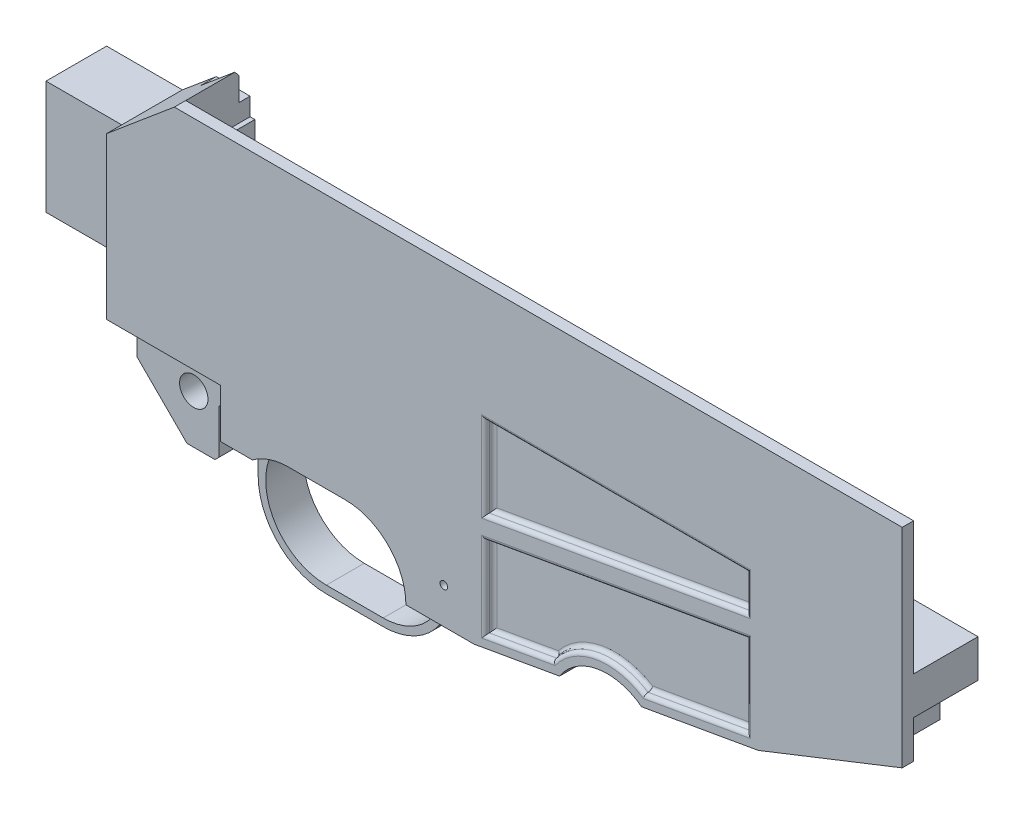
from build123d import *

# Parameters (mm, degrees)
EXTRUDE_1_DEPTH      = 20
SKETCH_3_W           = 72.75
SKETCH_3_H           = 52
CUT_EXTRUDE_1_DEPTH  = 8
SKETCH_4_W           = 173.123696111
SKETCH_4_H           = 12.22
CUT_EXTRUDE_2_DEPTH  = 17
CUT_EXTRUDE_3_DEPTH  = 14
CUT_EXTRUDE_4_DEPTH  = 5
CUT_EXTRUDE_5_DEPTH  = 8
CUT_EXTRUDE_7_REACH  = 254.082
SKETCH_9_W           = 18
SKETCH_9_H           = 10
SKETCH_9_W_2         = 7.5
SKETCH_9_4_W         = 7.5
SKETCH_9_4_H         = 10
SKETCH_9_4_W_2       = 18
CUT_EXTRUDE_9_DEPTH  = 30.86
FILLET_START         = 50
FILLET_2_DEPTH       = 1.9999999
FILLET_START_2       = 51.9999999
FILLET_2_2_DEPTH     = 6.480525325
FILLET_START_3       = 10
FILLET_2_3_DEPTH     = 10.0000001
SKETCH_8_W           = 8.39
SKETCH_8_H           = 12.86
CUT_EXTRUDE_11_DEPTH = 6
CHAMFER_2_SIZE       = 1
FILLET_3_SIZE        = 6
FILLET_3_SIZE_2      = 8
SKETCH_11_W          = 118.13
SKETCH_11_H          = 35
CUT_EXTRUDE_15_DEPTH = 17
SKETCH_12_W          = 10
SKETCH_12_H          = 25
CUT_EXTRUDE_16_DEPTH = 17
CUT_EXTRUDE_18_REACH = 248.442
SKETCH_18_R          = 1.75
CUT_EXTRUDE_20_DEPTH = 6
CUT_EXTRUDE_21_DEPTH = 4.25
CUT_EXTRUDE_22_REACH = 248.028
SKETCH_21_R          = 1
FILLET_5_R           = 2
CUT_EXTRUDE_23_REACH = 247.923
SKETCH_22_R          = 3.75
CHAMFER_3_SIZE       = 1
SKETCH_23_W          = 4.5
SKETCH_23_H          = 35
CUT_EXTRUDE_24_DEPTH = 2
SKETCH_24_R          = 2.5
CUT_EXTRUDE_25_DEPTH = 5
SKETCH_25_W          = 20
SKETCH_25_H          = 30
CUT_EXTRUDE_26_DEPTH = 4
CUT_EXTRUDE_27_DEPTH = 2
FILLET_6_R           = 1
SKETCH_32_W          = 3
SKETCH_32_H          = 7.5
CUT_EXTRUDE_28_DEPTH = 10
CHAMFER_5_SIZE       = 1
SKETCH_33_R          = 2
CUT_EXTRUDE_29_DEPTH = 246.408981914
CHAMFER_6_SIZE       = 1
EXTRUDE_2_DEPTH      = 2
CHAMFER_7_SIZE       = 0.5


with BuildPart() as part:
    # 스케치2 → 보스-돌출1 (new body)
    with BuildSketch(Plane.XY):
        with BuildLine():
            Line((0, 0), (20, 0))
            Line((20, 0), (37.876303889, 15))
            Line((37.876303889, 15), (230, 15))
            Line((230, 15), (230, -54.995476447))
            Line((230, -54.995476447), (192, -54.995476447))
            Line((192, -54.995476447), (161.21786811, -60.423196823))
            ThreePointArc((161.21786811, -60.423196823), (149.551131055, -57.604318381), (139.552097544, -64.243456731))
            Line((139.552097544, -64.243456731), (117, -68.22))
            Line((117, -68.22), (101, -68.22))
            ThreePointArc((101, -68.22), (95.727922061, -80.947922061), (83, -86.22))
            Line((83, -86.22), (68, -86.22))
            ThreePointArc((68, -86.22), (55.272077939, -80.947922061), (50, -68.22))
            Line((50, -68.22), (33.22, -68.22))
            Line((33.22, -68.22), (20, -55))
            Line((20, -55), (20, -30))
            Line((20, -30), (0, -30))
            Line((0, -30), (0, 0))
        make_face()
        with BuildLine():
            Line((68, -52.22), (83, -52.22))
            ThreePointArc((83, -52.22), (99, -68.22), (83, -84.22))
            Line((83, -84.22), (68, -84.22))
            ThreePointArc((68, -84.22), (52, -68.22), (68, -52.22))
        make_face(mode=Mode.SUBTRACT)
    extrude(amount=EXTRUDE_1_DEPTH)

    # 스케치3 → 컷-돌출1 (cut)
    with BuildSketch(Plane(origin=(0, 0, 0), x_dir=(-1, 0, 0), z_dir=(0, 0, -1))):
        with Locations((-75.5, -23.22)):
            Rectangle(SKETCH_3_W, SKETCH_3_H)
    extrude(amount=-CUT_EXTRUDE_1_DEPTH, mode=Mode.SUBTRACT)

    # 스케치4 → 컷-돌출2 (cut)
    with BuildSketch(Plane(origin=(0, 0, 0), x_dir=(-1, 0, 0), z_dir=(0, 0, -1))):
        with Locations((-124.438151944, 8.89)):
            Rectangle(SKETCH_4_W, SKETCH_4_H)
    extrude(amount=-CUT_EXTRUDE_2_DEPTH, mode=Mode.SUBTRACT)

    # 스케치5 → 컷-돌출3 (cut)
    with BuildSketch(Plane(origin=(0, 0, 0), x_dir=(-1, 0, 0), z_dir=(0, 0, -1))):
        with BuildLine():
            Line((-117, 2.78), (-192, 2.78))
            Line((-192, 2.78), (-192, -54.995476447))
            Line((-192, -54.995476447), (-161.21786811, -60.423196823))
            ThreePointArc((-161.21786811, -60.423196823), (-149.551131055, -57.604318381), (-139.552097544, -64.243456731))
            Line((-139.552097544, -64.243456731), (-117, -68.22))
            Line((-117, -68.22), (-117, 2.78))
        make_face()
    extrude(amount=-CUT_EXTRUDE_3_DEPTH, mode=Mode.SUBTRACT)

    # 스케치6 → 컷-돌출4 (cut)
    with BuildSketch(Plane(origin=(0, 0, 0), x_dir=(-1, 0, 0), z_dir=(0, 0, -1))):
        with BuildLine():
            Line((-88, -49.22), (-63, -49.22))
            Line((-63, -49.22), (-63, -53.021315846))
            ThreePointArc((-63, -53.021315846), (-65.468098191, -52.421599029), (-68, -52.22))
            Line((-68, -52.22), (-83, -52.22))
            ThreePointArc((-83, -52.22), (-85.531901809, -52.421599029), (-88, -53.021315846))
            Line((-88, -53.021315846), (-88, -49.22))
        make_face()
    extrude(amount=-CUT_EXTRUDE_4_DEPTH, mode=Mode.SUBTRACT)

    # 스케치7 → 컷-돌출5 (cut)
    with BuildSketch(Plane.XY.offset(20)):
        Polygon((20, -42.5), (50, -42.5), (50, -68.22), (33.22, -68.22), (20, -55), align=None)
    extrude(amount=-CUT_EXTRUDE_5_DEPTH, mode=Mode.SUBTRACT)

    # 컷-돌출7: up to this face of the body (flat: up to its plane)
    cut_extrude_7_end = Plane(part.part.faces().sort_by_distance((109, -68.22, 10))[0])
    # 스케치9 → 컷-돌출7 (cut, up to the picked face)
    with BuildSketch(Plane.XZ.offset(86.22), mode=Mode.PRIVATE) as cut_extrude_7_sk1:
        with Locations((92, 15)):
            Rectangle(SKETCH_9_W, SKETCH_9_H)
    cut_extrude_7_tool1 = split(extrude(cut_extrude_7_sk1.sketch, amount=-CUT_EXTRUDE_7_REACH, mode=Mode.PRIVATE), bisect_by=cut_extrude_7_end, keep=Keep.BOTH, mode=Mode.PRIVATE)
    # 스케치9 → 컷-돌출7 (cut, up to the picked face)
    with BuildSketch(Plane.XZ.offset(86.22), mode=Mode.PRIVATE) as cut_extrude_7_sk2:
        with Locations((79.25, 15)):
            Rectangle(SKETCH_9_W_2, SKETCH_9_H)
    cut_extrude_7_tool2 = split(extrude(cut_extrude_7_sk2.sketch, amount=-CUT_EXTRUDE_7_REACH, mode=Mode.PRIVATE), bisect_by=cut_extrude_7_end, keep=Keep.BOTH, mode=Mode.PRIVATE)
    add(cut_extrude_7_tool1.solids().sort_by(Axis((92, -86.22, 15), (0, 1, 0)))[0], mode=Mode.SUBTRACT)
    add(cut_extrude_7_tool2.solids().sort_by(Axis((79.25, -86.22, 15), (0, 1, 0)))[0], mode=Mode.SUBTRACT)

    # 스케치9<4> → 컷-돌출9 (cut)
    with BuildSketch(Plane.XZ.offset(86.22)):
        with Locations((71.75, 15)):
            Rectangle(SKETCH_9_4_W, SKETCH_9_4_H)
        with Locations((59, 15)):
            Rectangle(SKETCH_9_4_W_2, SKETCH_9_4_H)
    extrude(amount=-CUT_EXTRUDE_9_DEPTH, mode=Mode.SUBTRACT)

    # 필렛2: read off the stored shape, not the designer's step
    # 필렛2 outline → 필렛2 (add)
    with BuildSketch(Plane.YZ.offset(FILLET_START)):
        with BuildLine():
            Line((-55.36, 10), (-55.36, 19))
            add(Edge.make_bspline(
                [(-55.36, 19), (-55.36, 10), (-62.86, 10)],
                knots=[0, 0, 0, 1, 1, 1], degree=2, weights=[1, 0.707106781, 1]))
            Line((-62.86, 10), (-55.36, 10))
        make_face()
    extrude(amount=FILLET_2_DEPTH)

    # Fillet 2 2 outline → Fillet 2 2 (add)
    with BuildSketch(Plane.YZ.offset(FILLET_START_2)):
        with BuildLine():
            Line((-55.36, 10), (-55.36, 19))
            add(Edge.make_bspline(
                [(-55.36, 19), (-55.36, 10), (-62.86, 10)],
                knots=[0, 0, 0, 1, 1, 1], degree=2, weights=[1, 0.707106781, 1]))
            Line((-62.86, 10), (-55.36, 10))
        make_face()
    extrude(amount=FILLET_2_2_DEPTH)

    # Fillet 2 3 outline → Fillet 2 3 (cut)
    with BuildSketch(Plane.XY.offset(FILLET_START_3)):
        with BuildLine():
            ThreePointArc((58.480525225, -55.36), (54.796795727, -59.182555841), (52.566542837, -64))
            Line((52.566542837, -64), (58.480525225, -64))
            Line((58.480525225, -64), (58.480525225, -55.36))
        make_face()
    extrude(amount=FILLET_2_3_DEPTH, mode=Mode.SUBTRACT)

    # 스케치8 → 컷-돌출11 (cut)
    with BuildSketch(Plane.XY.offset(12)):
        with Locations((45.805, -61.79)):
            Rectangle(SKETCH_8_W, SKETCH_8_H)
    extrude(amount=-CUT_EXTRUDE_11_DEPTH, mode=Mode.SUBTRACT)

    # 모따기2
    chamfer_2_edges = [part.edges().sort_by_distance(p)[0] for p in [
        (41.61, -68.22, 9),
    ]]
    chamfer(chamfer_2_edges, length=CHAMFER_2_SIZE)

    # 필렛3
    # a fillet whose section is not a circle: 8, 6 mm, written as the material it adds along each edge
    with BuildSketch(Plane(origin=(121, -68.22, 10), x_dir=(0, 0, 1), z_dir=(-1, 0, 0))) as fillet_3_piece_1_section:
        with BuildLine():
            Bezier((FILLET_3_SIZE, 0), (0, 0), (0, -FILLET_3_SIZE_2), weights=[1, 0.707106781, 1])
            Line((0, -FILLET_3_SIZE_2), (0, 0))
            Line((0, 0), (FILLET_3_SIZE, 0))
        make_face()
    fillet_3_piece_1 = extrude(amount=42, mode=Mode.PRIVATE)
    fillet_3_piece_1 = fillet_3_piece_1 - Plane(origin=(83, -68.22, 10), x_dir=(0, 1, 0), z_dir=(0, 0, -1)) * Cylinder(16, 117, mode=Mode.PRIVATE)
    fillet_3_piece_1 = fillet_3_piece_1 & Plane(origin=(83, -68.22, 10), x_dir=(1, 0, 0), z_dir=(0, 0, -1)) * Cylinder(18, 117, mode=Mode.PRIVATE)
    add(fillet_3_piece_1)

    # 스케치11 → 컷-돌출15 (cut)
    with BuildSketch(Plane(origin=(0, 0, 0), x_dir=(-1, 0, 0), z_dir=(0, 0, -1))):
        with Locations((-170.935, -2.5)):
            Rectangle(SKETCH_11_W, SKETCH_11_H)
    extrude(amount=-CUT_EXTRUDE_15_DEPTH, mode=Mode.SUBTRACT)

    # 스케치12 → 컷-돌출16 (cut)
    with BuildSketch(Plane(origin=(0, 0, 0), x_dir=(-1, 0, 0), z_dir=(0, 0, -1))):
        with Locations((-225, -42.495476447)):
            Rectangle(SKETCH_12_W, SKETCH_12_H)
    extrude(amount=-CUT_EXTRUDE_16_DEPTH, mode=Mode.SUBTRACT)

    # 스케치16 → 컷-돌출18 (cut, up to next)
    with BuildSketch(Plane.XY.offset(20), mode=Mode.PRIVATE) as cut_extrude_18_sk1:
        Polygon((192, -54.995476447), (230, -39.995476447), (230, -54.995476447), align=None)
    cut_extrude_18_tool1 = extrude(cut_extrude_18_sk1.sketch, amount=-CUT_EXTRUDE_18_REACH, mode=Mode.PRIVATE) & part.part
    add(cut_extrude_18_tool1.solids().sort_by_distance((217.333333, -49.995476, 20))[0], mode=Mode.SUBTRACT)

    # 스케치18 → 컷-돌출20 (cut)
    with BuildSketch(Plane(origin=(0, 0, 0), x_dir=(-1, 0, 0), z_dir=(0, 0, -1))):
        with Locations((-109, -58.72)):
            Circle(SKETCH_18_R)
    extrude(amount=-CUT_EXTRUDE_20_DEPTH, mode=Mode.SUBTRACT)

    # 스케치20 → 컷-돌출21 (cut)
    with BuildSketch(Plane(origin=(0, 0, 0), x_dir=(-1, 0, 0), z_dir=(0, 0, -1))):
        Polygon((-113, -68.22), (-103, -68.22), (-103, -50.22), (-111.875, -50.22), (-111.875, -36.22), (-117, -36.22), (-117, -64.22), (-117, -68.22), align=None)
    extrude(amount=-CUT_EXTRUDE_21_DEPTH, mode=Mode.SUBTRACT)

    # 스케치21 → 컷-돌출22 (cut, up to next)
    with BuildSketch(Plane(origin=(0, 0, 6), x_dir=(-1, 0, 0), z_dir=(0, 0, -1)), mode=Mode.PRIVATE) as cut_extrude_22_sk1:
        with Locations((-109, -58.72)):
            Circle(SKETCH_21_R)
    cut_extrude_22_tool1 = extrude(cut_extrude_22_sk1.sketch, amount=-CUT_EXTRUDE_22_REACH, mode=Mode.PRIVATE) & part.part
    add(cut_extrude_22_tool1.solids().sort_by_distance((109, -58.72, 6))[0], mode=Mode.SUBTRACT)

    # 필렛5
    fillet_5_edges = [part.edges().sort_by_distance(p)[0] for p in [
        (103, -50.22, 2.125),
    ]]
    fillet(fillet_5_edges, radius=FILLET_5_R)

    # 스케치22 → 컷-돌출23 (cut, up to next)
    with BuildSketch(Plane.XY.offset(12), mode=Mode.PRIVATE) as cut_extrude_23_sk1:
        with Locations((35, -55.36)):
            Circle(SKETCH_22_R)
    cut_extrude_23_tool1 = extrude(cut_extrude_23_sk1.sketch, amount=-CUT_EXTRUDE_23_REACH, mode=Mode.PRIVATE) & part.part
    add(cut_extrude_23_tool1.solids().sort_by_distance((35, -55.36, 12))[0], mode=Mode.SUBTRACT)

    # 모따기3
    chamfer_3_edges = [part.edges().sort_by_distance(p)[0] for p in [
        (111.875, -50.22, 2.125),
    ]]
    chamfer(chamfer_3_edges, length=CHAMFER_3_SIZE - 0.0001)  # a hair under: the kernel refuses the full size

    # 스케치23 → 컷-돌출24 (cut)
    with BuildSketch(Plane(origin=(117, 0, 0), x_dir=(0, 0, -1), z_dir=(1, 0, 0))):
        with Locations((-2.25, -50.72)):
            Rectangle(SKETCH_23_W, SKETCH_23_H)
    extrude(amount=-CUT_EXTRUDE_24_DEPTH, mode=Mode.SUBTRACT)

    # 스케치24 → 컷-돌출25 (cut, symmetric)
    with BuildSketch(Plane(origin=(103, 0, 0), x_dir=(0, 0, -1), z_dir=(1, 0, 0))):
        with Locations((0, -53.72)):
            Circle(SKETCH_24_R)
    extrude(amount=CUT_EXTRUDE_25_DEPTH, both=True, mode=Mode.SUBTRACT)

    # 스케치25 → 컷-돌출26 (cut)
    with BuildSketch(Plane.XY.offset(20)):
        with Locations((10, -15)):
            Rectangle(SKETCH_25_W, SKETCH_25_H)
    extrude(amount=-CUT_EXTRUDE_26_DEPTH, mode=Mode.SUBTRACT)

    # 스케치30 → 컷-돌출27 (cut)
    with BuildSketch(Plane.XY.offset(20)):
        with BuildLine():
            Line((120, -43.147704093), (120, -64.644739222))
            Line((120, -64.644739222), (137.810226103, -61.504315828))
            ThreePointArc((137.810226103, -61.504315828), (149.030186522, -54.649895122), (161.917850486, -57.253491208))
            Line((161.917850486, -57.253491208), (189, -52.478177553))
            Line((189, -52.478177553), (189, -30.981142425))
            Line((189, -30.981142425), (120, -43.147704093))
        make_face()
        Polygon((120, -15.741822447), (120, -37.238857575), (189, -25.072295907), (189, -15.741822447), align=None)
    extrude(amount=-CUT_EXTRUDE_27_DEPTH, mode=Mode.SUBTRACT)

    # 필렛6
    fillet_6_edges = [part.edges().sort_by_distance(p)[0] for p in [
        (128.905113051, -63.074527525, 20),
        (128.905113051, -63.074527525, 18),
        (149.030186522, -54.649895122, 20),
        (149.030186522, -54.649895122, 18),
        (175.458925243, -54.865834381, 18),
        (175.458925243, -54.865834381, 20),
        (189, -41.729659989, 20),
        (120, -53.896221658, 20),
        (120, -53.896221658, 18),
        (189, -41.729659989, 18),
        (154.5, -37.064423259, 20),
        (154.5, -37.064423259, 18),
        (189, -20.407059177, 20),
        (189, -20.407059177, 18),
        (154.5, -31.155576741, 20),
        (154.5, -31.155576741, 18),
        (120, -26.490340011, 18),
        (120, -26.490340011, 20),
        (154.5, -15.741822447, 18),
        (154.5, -15.741822447, 20),
    ]]
    fillet(fillet_6_edges, radius=FILLET_6_R - 0.0001)  # a hair under: the kernel refuses the full size

    # 스케치32 → 컷-돌출28 (cut)
    with BuildSketch(Plane(origin=(37.876303889, 0, 0), x_dir=(0, 0, -1), z_dir=(1, 0, 0))):
        with Locations((-1.5, 11.25)):
            Rectangle(SKETCH_32_W, SKETCH_32_H)
    extrude(amount=-CUT_EXTRUDE_28_DEPTH, mode=Mode.SUBTRACT)

    # 모따기5
    chamfer_5_edges = [part.edges().sort_by_distance(p)[0] for p in [
        (33.407227917, 11.25, 3),
    ]]
    chamfer(chamfer_5_edges, length=CHAMFER_5_SIZE)

    # 스케치33 → 컷-돌출29 (cut, through all)
    with BuildSketch(Plane.XZ.offset(68.22)):
        with Locations((43.375, 0)):
            Circle(SKETCH_33_R)
    extrude(amount=-CUT_EXTRUDE_29_DEPTH, mode=Mode.SUBTRACT)

    # 모따기6
    chamfer_6_edges = [part.edges().sort_by_distance(p)[0] for p in [
        (43.375, -68.22, 2),
    ]]
    chamfer(chamfer_6_edges, length=CHAMFER_6_SIZE)

    # 보스-돌출2: read off the stored shape, not the designer's step
    # 보스-돌출2 outline → 보스-돌출2 (add)
    with BuildSketch(Plane(origin=(0, -49.22, 0), x_dir=(1, 0, 0), z_dir=(0, 1, 0))):
        with BuildLine():
            Line((101.6, 0), (97.65, 0))
            ThreePointArc((97.65, 0), (99.625, -1.975), (101.6, 0))
        make_face()
    extrude(amount=EXTRUDE_2_DEPTH)

    # 모따기7
    chamfer_7_edges = [part.edges().sort_by_distance(p)[0] for p in [
        (99.625, -47.22, 1.975),
    ]]
    chamfer(chamfer_7_edges, length=CHAMFER_7_SIZE)


solid = part.part
